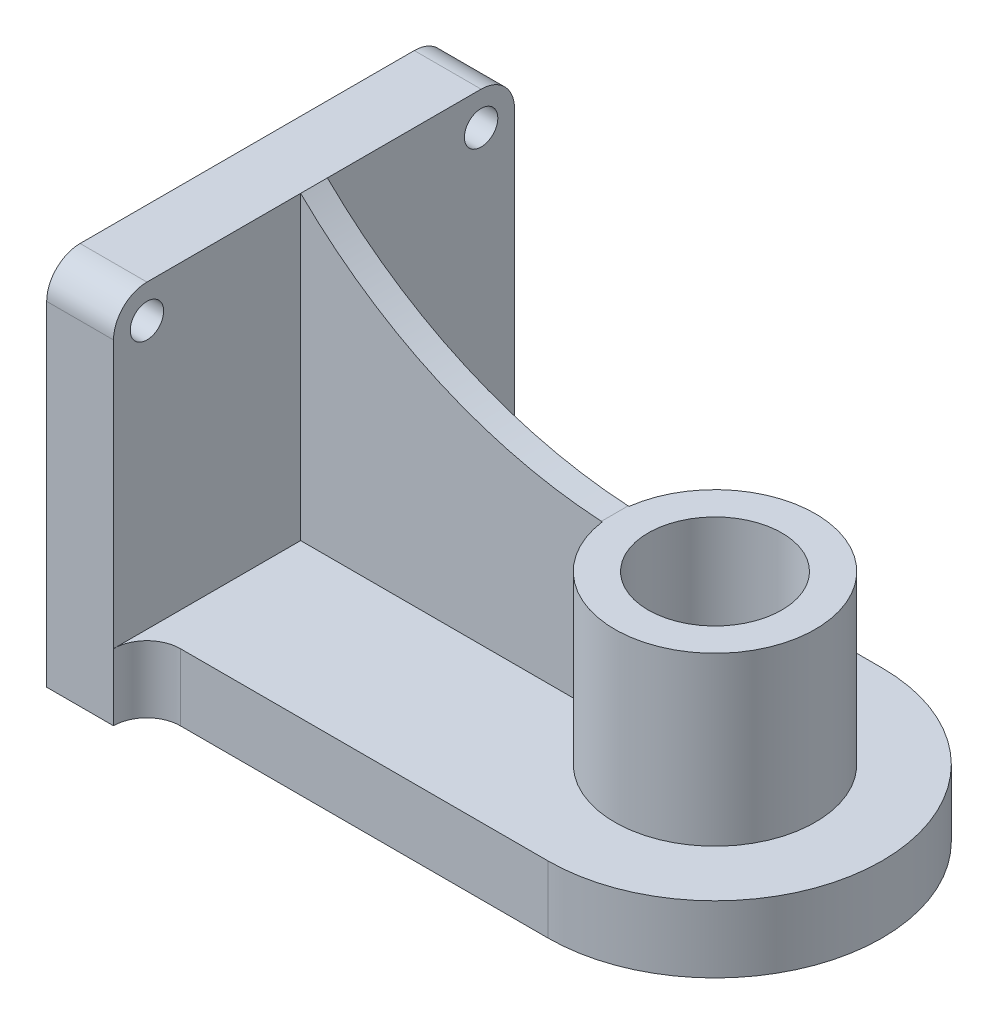
from build123d import *

# Parameters (mm, degrees)
SKETCH1_W           = 10
SKETCH1_H           = 55
BOSS_EXTRUDE1_DEPTH = 30
BOSS_EXTRUDE2_START = -27.5
BOSS_EXTRUDE2_DEPTH = 10
FILLET3_R           = 5
FILLET4_R           = 5
SKETCH3_R           = 15
BOSS_EXTRUDE3_DEPTH = 25
HOLE1_D             = 20
FILLET5_R           = 5
HOLE2_D             = 5
BOSS_EXTRUDE7_DEPTH = 2


with BuildPart() as part:
    # Sketch1 → Boss-Extrude1 (new, symmetric)
    with BuildSketch(Plane.XY):
        Rectangle(SKETCH1_W, SKETCH1_H)
    extrude(amount=BOSS_EXTRUDE1_DEPTH, both=True)

    # Sketch2 → Boss-Extrude2 (add)
    with BuildSketch(Plane(origin=(0, 0, 0), x_dir=(1, 0, 0), z_dir=(0, 1, 0)).offset(BOSS_EXTRUDE2_START)):
        with BuildLine():
            Line((65, 25), (3, 25))
            Line((3, 25), (3, -25))
            Line((3, -25), (65, -25))
            ThreePointArc((65, -25), (90, 0), (65, 25))
        make_face()
    extrude(amount=BOSS_EXTRUDE2_DEPTH)

    # Fillet3
    fillet3_edges = [part.edges().sort_by_distance(p)[0] for p in [
        (5, -22.5, 25),
    ]]
    fillet(fillet3_edges, radius=FILLET3_R - 0.0001)  # a hair under: the kernel refuses the full size

    # Fillet4
    fillet4_edges = [part.edges().sort_by_distance(p)[0] for p in [
        (5, -22.5, -25),
    ]]
    fillet(fillet4_edges, radius=FILLET4_R - 0.0001)  # a hair under: the kernel refuses the full size

    # Sketch3 → Boss-Extrude3 (add)
    with BuildSketch(Plane(origin=(0, -17.5, 0), x_dir=(1, 0, 0), z_dir=(0, 1, 0))):
        with Locations(Location((65, 0, 0), (0, 0, 270))):
            Circle(SKETCH3_R)
    extrude(amount=BOSS_EXTRUDE3_DEPTH)

    # Hole1 (through all)
    with Locations(Plane(origin=(0, 7.5, 0), x_dir=(1, 0, 0), z_dir=(0, 1, 0))):
        with Locations((65, 0)):
            Hole(HOLE1_D / 2)

    # Fillet5
    fillet5_edges = [part.edges().sort_by_distance(p)[0] for p in [
        (0, 27.5, -30),
        (0, 27.5, 30),
    ]]
    fillet(fillet5_edges, radius=FILLET5_R)

    # Hole2 (through all)
    with Locations(Plane(origin=(5, 0, 0), x_dir=(0, 0, -1), z_dir=(1, 0, 0))):
        with Locations((-25, 22.5), (25, 22.5)):
            Hole(HOLE2_D / 2)

    # Sketch9 → Boss-Extrude7 (add, symmetric)
    with BuildSketch(Plane.XY):
        with BuildLine():
            Line((51.5, 7.5), (51.5, -17.5))
            Line((51.5, -17.5), (10, -17.5))
            Line((10, -17.5), (5, -17.5))
            Line((5, -17.5), (3, -17.5))
            Line((3, -17.5), (3, 27.5))
            Line((3, 27.5), (5, 27.5))
            ThreePointArc((5, 27.5), (25.683225718, 13.412257866), (50, 7.5))
            Line((50, 7.5), (51.5, 7.5))
        make_face()
    extrude(amount=BOSS_EXTRUDE7_DEPTH, both=True)


solid = part.part
